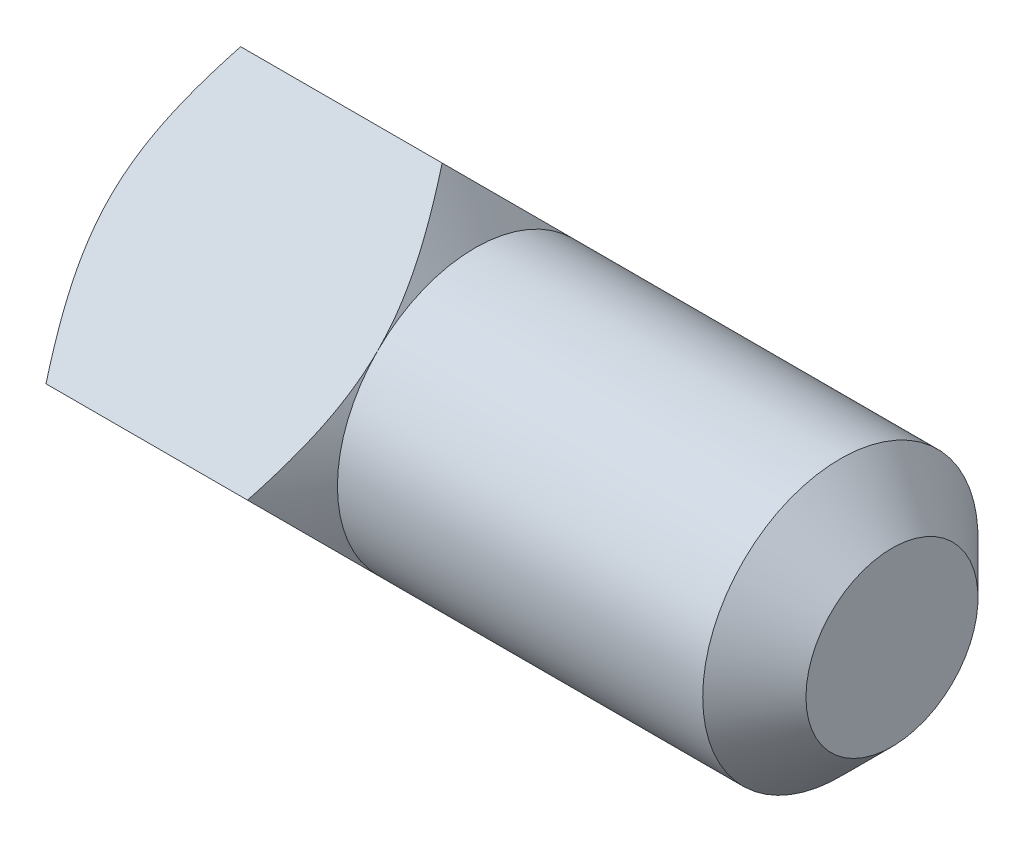
from build123d import *

# Parameters (mm, degrees)
BASEHEAD_DEPTH = 4
BODYSKE_W      = 6.53602765
BODYSKE_H      = 2


with BuildPart() as part:
    # BaseHeadSke → BaseHead (new body)
    with BuildSketch(Plane(origin=(0, 0, 0), x_dir=(0, 0, -1), z_dir=(1, 0, 0))):
        Polygon((0, 2.828427125), (2.828427125, 0), (0, -2.828427125), (-2.828427125, 0), align=None)
    extrude(amount=BASEHEAD_DEPTH)

    # HeadChamferSke → HeadChamfer (revolve, cut)
    with BuildSketch(Plane.XY):
        Polygon((0, 2.828427125), (0, 1.9), (0.53602765, 2.828427125), align=None)
        Polygon((3.46397235, 2.828427125), (4, 1.9), (4, 2.828427125), align=None)
    revolve(axis=Axis((0, 0, 0), (1, 0, 0)), mode=Mode.SUBTRACT)

    # BodySke → BaseBody (revolve)
    with BuildSketch(Plane.XY):
        with Locations((6.731986175, 1)):
            Rectangle(BODYSKE_W, BODYSKE_H)
    revolve(axis=Axis((0, 0, 0), (1, 0, 0)))

    # ChamferEndSke → ChamferEnd (revolve, cut)
    with BuildSketch(Plane.XY):
        Polygon((10, 2), (10, 1.25), (9.25, 2), align=None)
    revolve(axis=Axis((0, 0, 0), (1, 0, 0)), mode=Mode.SUBTRACT)


solid = part.part
